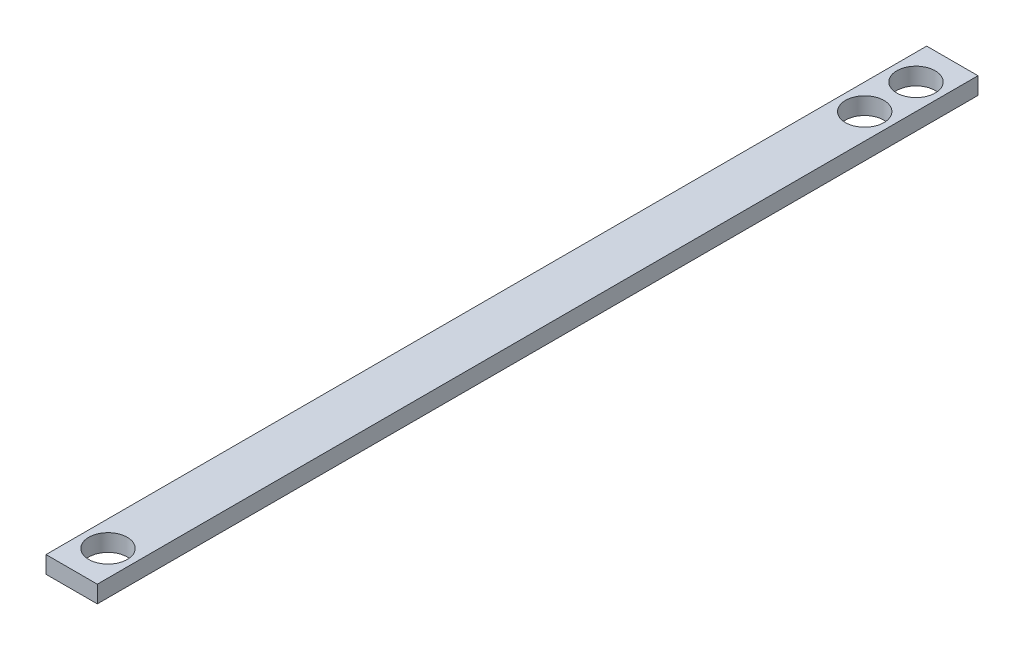
from build123d import *

# Parameters (mm, degrees)
SKETCH1_W           = 38.1
SKETCH1_H           = 12.7
BOSS_EXTRUDE1_DEPTH = 615.95
SKETCH2_R           = 14.3002
CUT_EXTRUDE1_DEPTH  = 762
SKETCH3_W           = 38.1
SKETCH3_H           = 12.7
BOSS_EXTRUDE2_DEPTH = 38.1
SKETCH4_R           = 14.3002
CUT_EXTRUDE2_DEPTH  = 101.6


with BuildPart() as part:
    # Sketch1 → Boss-Extrude1 (new body)
    with BuildSketch(Plane.XY):
        with Locations((19.05, 6.35)):
            Rectangle(SKETCH1_W, SKETCH1_H)
    extrude(amount=BOSS_EXTRUDE1_DEPTH)

    # Sketch2 → Cut-Extrude1 (cut)
    with BuildSketch(Plane(origin=(0, 12.7, 0), x_dir=(1, 0, 0), z_dir=(0, 1, 0))):
        with Locations((19.05, -588.9498)):
            Circle(SKETCH2_R)
        with Locations((19.05, -27.0002)):
            Circle(SKETCH2_R)
    extrude(amount=-CUT_EXTRUDE1_DEPTH, mode=Mode.SUBTRACT)

    # Sketch3 → Boss-Extrude2 (add)
    with BuildSketch(Plane(origin=(0, 0, 0), x_dir=(-1, 0, 0), z_dir=(0, 0, -1))):
        with Locations((-19.05, 6.35)):
            Rectangle(SKETCH3_W, SKETCH3_H)
    extrude(amount=BOSS_EXTRUDE2_DEPTH)

    # Sketch4 → Cut-Extrude2 (cut)
    with BuildSketch(Plane(origin=(0, 12.7, 0), x_dir=(1, 0, 0), z_dir=(0, 1, 0))):
        with Locations((19.05, 11.0998)):
            Circle(SKETCH4_R)
    extrude(amount=-CUT_EXTRUDE2_DEPTH, mode=Mode.SUBTRACT)


solid = part.part
